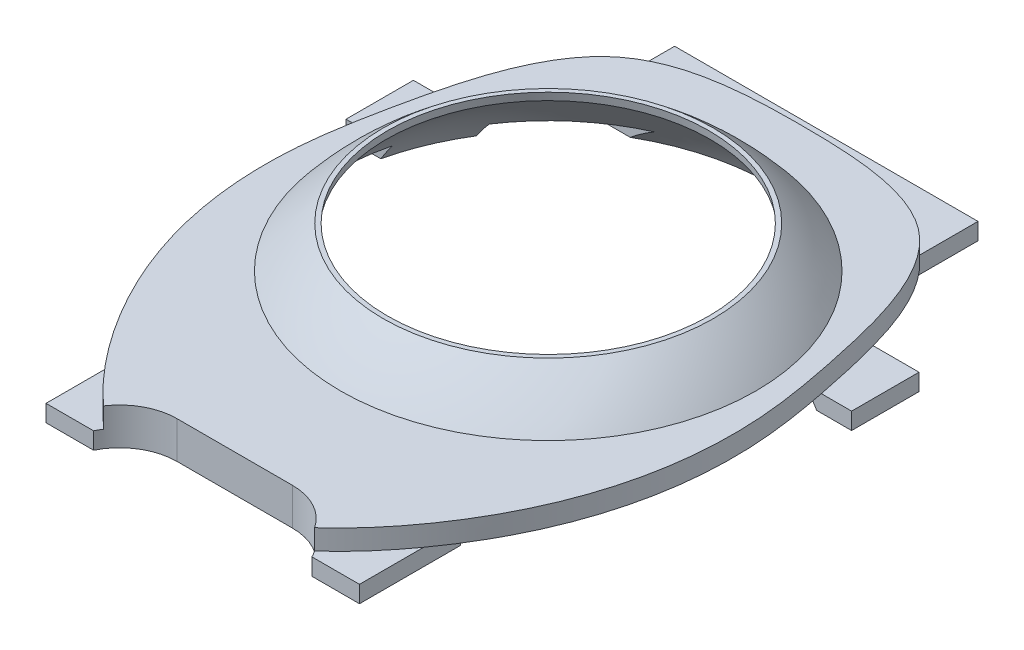
from build123d import *

# Parameters (mm, degrees)
BOSS_EXTRUDE1_DEPTH     = 1.2
SKETCH1_W               = 18.6
SKETCH1_H               = 6
SKETCH1_W_2             = 5
SKETCH1_H_2             = 4
SKETCH1_W_3             = 18
SKETCH1_H_3             = 5
BOSS_EXTRUDE2_DEPTH     = 1
CUT_EXTRUDE1_DEPTH      = 52.851446584
CUT_EXTRUDE1_DEPTH_BACK = 52.851446584


with BuildPart() as part:
    # Sketch6 → Boss-Extrude1 (new body)
    with BuildSketch(Plane(origin=(0, 0, 0), x_dir=(1, 0, 0), z_dir=(0, 1, 0))):
        with BuildLine():
            add(Edge.make_bspline(
                [(-9, 46), (-6.810698513, 47.793099443), (0, 48.206900557), (10.448492197, 47.572076141), (12.778700853, 38.443421929), (14.458520099, 29.362507061), (12.47472011, 18.569421958), (0, 5.572850968), (-12.47472011, 18.569421958), (-14.458520099, 29.362507061), (-12.778700853, 38.443421929), (-11.338740176, 44.08450607), (-9, 46)],
                knots=[0, 0, 0, 0, 0.089262652, 0.178525303, 0.2738809, 0.322906095, 0.451657084, 0.589262652, 0.726868219, 0.855619208, 0.904644403, 1, 1, 1, 1], degree=3))
        make_face()
    extrude(amount=BOSS_EXTRUDE1_DEPTH)

    # Sketch1 → Boss-Extrude2 (add)
    with BuildSketch(Plane(origin=(0, 0, 0), x_dir=(1, 0, 0), z_dir=(0, 1, 0))):
        with Locations((0, 15.5)):
            Rectangle(SKETCH1_W, SKETCH1_H)
        with Locations((-12.5, 38)):
            Rectangle(SKETCH1_W_2, SKETCH1_H_2)
        with Locations((0, 47)):
            Rectangle(SKETCH1_W_3, SKETCH1_H_3)
        with Locations((12.5, 38)):
            Rectangle(SKETCH1_W_2, SKETCH1_H_2)
    extrude(amount=-BOSS_EXTRUDE2_DEPTH)

    # Sketch4 → Revolve1 (revolve)
    with BuildSketch(Plane.XY.offset(-33)):
        with BuildLine():
            Line((0, 0.8), (12.647529403, 0.8))
            ThreePointArc((12.647529403, 0.8), (11.312282074, 2.315134744), (9.796810706, 3.65))
            Line((9.796810706, 3.65), (0, 3.65))
            Line((0, 3.65), (0, 0.8))
        make_face()
    revolve(axis=Axis((0, 0.8, -33), (0, 1, 0)))

    # Sketch8 → Cut-Revolve1 (revolve, cut)
    with BuildSketch(Plane.XY.offset(-33), mode=Mode.PRIVATE) as cut_revolve1_sk:
        with BuildLine():
            Line((0, -1.5), (13.564659966, -1.5))
            ThreePointArc((13.564659966, -1.5), (7.874007874, 4.351029923), (0, 6.5))
            Line((0, 6.5), (0, -1.5))
        make_face()
    revolve(cut_revolve1_sk.sketch.rotate(Axis((0, 1.26, -33), (0, -1, 0)), 346.939895047), axis=Axis((0, 1.26, -33), (0, -1, 0)), mode=Mode.SUBTRACT)

    # Chamfer1: read off the stored shape, not the designer's step
    # Chamfer1 outline → Chamfer1 (revolve, cut)
    with BuildSketch(Plane.XY.offset(-33)):
        Polygon((0, 3.157313609), (9.615078045, 3.157313609), (9.530869127, 3.65), (0, 3.65), align=None)
    revolve(axis=Axis((0, 0, -33), (0, 1, 0)), mode=Mode.SUBTRACT)

    # Sketch11 → Cut-Extrude1 (cut, two sides: drawn at the far end of the back side and taken through both)
    with BuildSketch(Plane(origin=(0, 0, 0), x_dir=(1, 0, 0), z_dir=(0, 1, 0)).offset(-CUT_EXTRUDE1_DEPTH_BACK)):
        with BuildLine():
            Line((-0.174875881, -0.4), (0.174875881, -0.4))
            ThreePointArc((0.174875881, -0.4), (0.885724478, -0.206107073), (1.399675197, 0.321865326))
            Line((1.399675197, 0.321865326), (6.4, 9.353101507))
            ThreePointArc((6.4, 9.353101507), (6.354604553, 12.726346594), (3.425487375, 14.4))
            Line((3.425487375, 14.4), (-3.425487375, 14.4))
            ThreePointArc((-3.425487375, 14.4), (-6.354604553, 12.726346594), (-6.4, 9.353101507))
            Line((-6.4, 9.353101507), (-1.399675197, 0.321865326))
            ThreePointArc((-1.399675197, 0.321865326), (-0.885724478, -0.206107073), (-0.174875881, -0.4))
        make_face()
    extrude(amount=CUT_EXTRUDE1_DEPTH + CUT_EXTRUDE1_DEPTH_BACK, mode=Mode.SUBTRACT)


solid = part.part
